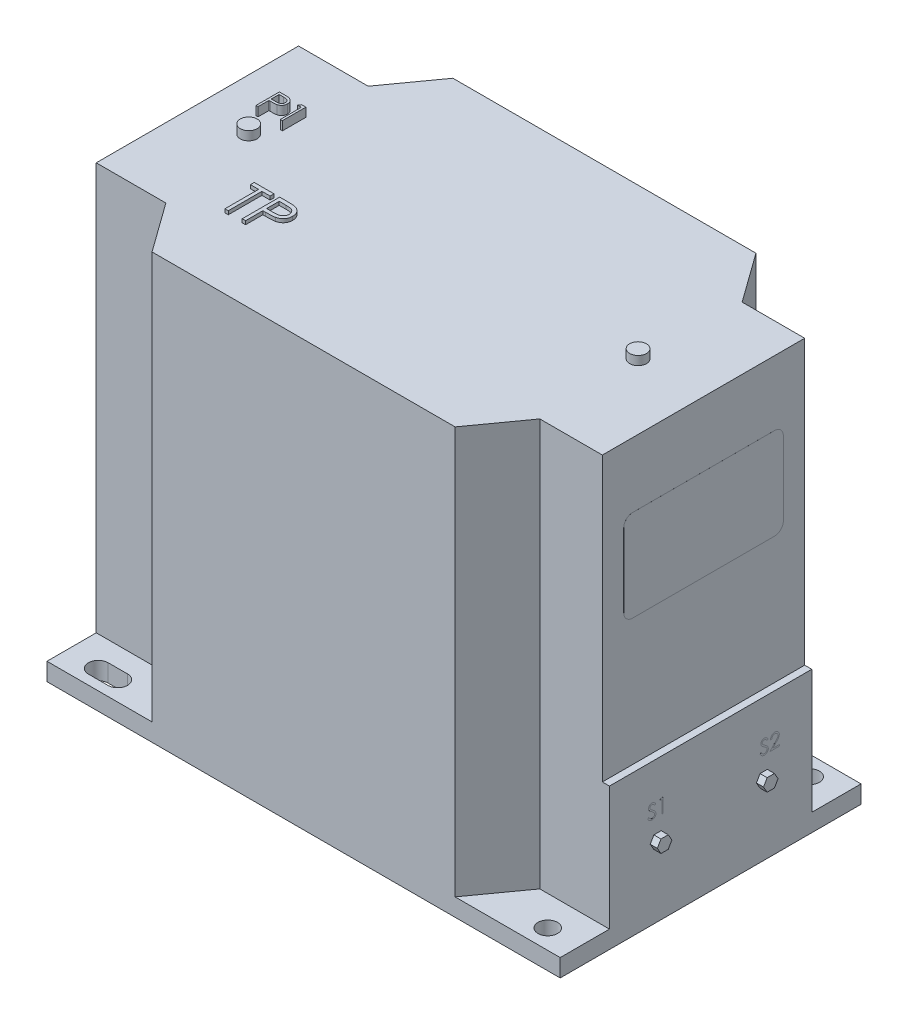
from build123d import *

# Parameters (mm, degrees)
CROQUIS1_W               = 290
CROQUIS1_H               = 170
SALIENTE_EXTRUIR1_DEPTH  = 240
CROQUIS2_R               = 5.5
CORTAR_EXTRUIR1_DEPTH    = 230
CROQUIS3_R               = 5.5
CORTAR_EXTRUIR3_DEPTH    = 309
CROQUIS4_W               = 114.318282822
CROQUIS4_H               = 160
CORTAR_EXTRUIR4_DEPTH    = 4
SALIENTE_EXTRUIR2_DEPTH  = 4
SALIENTE_EXTRUIR3_DEPTH  = 4
SALIENTE_EXTRUIR5_DEPTH  = 4
SALIENTE_EXTRUIR6_DEPTH  = 0.01
SALIENTE_EXTRUIR7_DEPTH  = 0.01
SALIENTE_EXTRUIR8_DEPTH  = 0.01
CROQUIS11_R              = 4.75
SALIENTE_EXTRUIR9_DEPTH  = 5
CROQUIS12_W              = 19.477537379
CROQUIS12_H              = 1.947753737
CROQUIS12_W_2            = 14.751875946
CROQUIS12_H_2            = 1.829107359
CROQUIS12_W_3            = 5.2253802
CROQUIS12_H_3            = 1.246064316
CROQUIS12_W_4            = 1.909821467
CROQUIS12_H_4            = 22.488415391
CROQUIS12_W_5            = 10.038203482
CROQUIS12_H_5            = 1.679080429
SALIENTE_EXTRUIR10_DEPTH = 0.1
SALIENTE_EXTRUIR11_DEPTH = 2


with BuildPart() as part:
    # Croquis1 → Saliente-Extruir1 (new body)
    with BuildSketch(Plane(origin=(0, 0, 0), x_dir=(1, 0, 0), z_dir=(0, 1, 0))):
        Rectangle(CROQUIS1_W, CROQUIS1_H)
    extrude(amount=SALIENTE_EXTRUIR1_DEPTH)

    # Croquis2 → Cortar-Extruir1 (cut)
    # profile 1 of 4: a face of its own
    with BuildSketch(Plane(origin=(0, 240, 0), x_dir=(1, 0, 0), z_dir=(0, 1, 0))):
        Polygon((-145, 85), (-145, 57.159141411), (-105.653068474, 57.159141411), (-85.626113794, 85), align=None)
        with BuildLine():
            ThreePointArc((-127, 68.5), (-132.5, 74), (-127, 79.5))
            Line((-127, 79.5), (-116, 79.5))
            ThreePointArc((-116, 79.5), (-110.5, 74), (-116, 68.5))
            Line((-116, 68.5), (-127, 68.5))
        make_face(mode=Mode.SUBTRACT)
    # profile 2 of 4: a face of its own
    with BuildSketch(Plane(origin=(0, 240, 0), x_dir=(1, 0, 0), z_dir=(0, 1, 0))):
        Polygon((-105.653068474, -57.159141411), (-145, -57.159141411), (-145, -85), (-85.626113794, -85), align=None)
        with BuildLine():
            Line((-116, -79.5), (-127, -79.5))
            ThreePointArc((-127, -79.5), (-132.5, -74), (-127, -68.5))
            Line((-127, -68.5), (-116, -68.5))
            ThreePointArc((-116, -68.5), (-110.5, -74), (-116, -79.5))
        make_face(mode=Mode.SUBTRACT)
    # profile 3 of 4: a face of its own
    with BuildSketch(Plane(origin=(0, 240, 0), x_dir=(1, 0, 0), z_dir=(0, 1, 0))):
        Polygon((145, 85), (85.626113794, 85), (105.653068474, 57.159141411), (145, 57.159141411), align=None)
        with Locations((127, 74)):
            Circle(CROQUIS2_R, mode=Mode.SUBTRACT)
    # profile 4 of 4: a face of its own
    with BuildSketch(Plane(origin=(0, 240, 0), x_dir=(1, 0, 0), z_dir=(0, 1, 0))):
        Polygon((105.653068474, -57.159141411), (85.626113794, -85), (145, -85), (145, -57.159141411), align=None)
        with Locations((127, -74)):
            Circle(CROQUIS2_R, mode=Mode.SUBTRACT)
    extrude(amount=-CORTAR_EXTRUIR1_DEPTH, mode=Mode.SUBTRACT)

    # Croquis3 → Cortar-Extruir3 (cut)
    with BuildSketch(Plane(origin=(0, 240, 0), x_dir=(1, 0, 0), z_dir=(0, 1, 0))):
        with Locations((127, 74)):
            Circle(CROQUIS3_R)
        with Locations((127, -74)):
            Circle(CROQUIS3_R)
        with BuildLine():
            Line((-127, 79.5), (-116, 79.5))
            ThreePointArc((-116, 79.5), (-110.5, 74), (-116, 68.5))
            Line((-116, 68.5), (-127, 68.5))
            ThreePointArc((-127, 68.5), (-132.5, 74), (-127, 79.5))
        make_face()
        with BuildLine():
            Line((-127, -68.426195021), (-116, -68.426195021))
            ThreePointArc((-116, -68.426195021), (-110.426195021, -74), (-116, -79.573804979))
            Line((-116, -79.573804979), (-127, -79.573804979))
            ThreePointArc((-127, -79.573804979), (-132.573804979, -74), (-127, -68.426195021))
        make_face()
    extrude(amount=-CORTAR_EXTRUIR3_DEPTH, mode=Mode.SUBTRACT)

    # Croquis4 → Cortar-Extruir4 (cut)
    with BuildSketch(Plane(origin=(145, 0, 0), x_dir=(0, 0, -1), z_dir=(1, 0, 0))):
        with Locations((0, 160)):
            Rectangle(CROQUIS4_W, CROQUIS4_H)
    extrude(amount=-CORTAR_EXTRUIR4_DEPTH, mode=Mode.SUBTRACT)

    # Croquis5 → Saliente-Extruir2 (add)
    with BuildSketch(Plane.ZY.offset(145)):
        Polygon((43.413866741, 29.419642397), (40.989340839, 33.619044445), (36.140289034, 33.619044445), (33.715763131, 29.419642397), (36.140289034, 25.220240349), (40.989340839, 25.220240349), align=None)
    extrude(amount=SALIENTE_EXTRUIR2_DEPTH)

    # Croquis6 → Saliente-Extruir3 (add)
    with BuildSketch(Plane.ZY.offset(145)):
        Polygon((43.413866741, 74.385865647), (40.989340839, 78.585267695), (36.140289034, 78.585267695), (33.715763131, 74.385865647), (36.140289034, 70.186463599), (40.989340839, 70.186463599), align=None)
    extrude(amount=SALIENTE_EXTRUIR3_DEPTH)

    # Croquis7 → Saliente-Extruir5 (add)
    with BuildSketch(Plane(origin=(145, 0, 0), x_dir=(0, 0, -1), z_dir=(1, 0, 0))):
        Polygon((-27.944874359, 36.440417974), (-32.055125641, 36.440417974), (-34.110251282, 40), (-32.055125641, 43.559582026), (-27.944874359, 43.559582026), (-25.889748718, 40), align=None)
        Polygon((34.110251282, 40), (32.055125641, 43.559582026), (27.944874359, 43.559582026), (25.889748718, 40), (27.944874359, 36.440417974), (32.055125641, 36.440417974), align=None)
    extrude(amount=SALIENTE_EXTRUIR5_DEPTH)

    # Croquis8 → Saliente-Extruir6 (add)
    with BuildSketch(Plane(origin=(145, 0, 0), x_dir=(0, 0, -1), z_dir=(1, 0, 0))):
        with BuildLine():
            Line((-35.585423462, 53.072879107), (-34.914424864, 53.475160256))
            add(Edge.make_bspline(
                [(-34.914424864, 53.475160256), (-34.852017433, 53.370692812), (-34.732447204, 53.17053722), (-34.532986086, 52.900077021), (-34.326309663, 52.67020213), (-34.110887424, 52.482249823), (-33.888034292, 52.33427467), (-33.656295455, 52.229494608), (-33.416451849, 52.164144093), (-33.253225504, 52.156206397), (-33.171736563, 52.15224359)],
                knots=[0, 0, 0, 0, 1.272034388, 2.437168799, 3.508375237, 4.49857839, 5.41946034, 6.295179144, 7.148887113, 8, 8, 8, 8], degree=3))
            add(Edge.make_bspline(
                [(-33.171736563, 52.15224359), (-33.102143147, 52.154181865), (-32.964174037, 52.1580245), (-32.761059665, 52.194947033), (-32.563797363, 52.251670968), (-32.376452774, 52.332907724), (-32.201610934, 52.431193218), (-32.048288607, 52.549906871), (-31.915741172, 52.682817373), (-31.80731693, 52.831095893), (-31.72413185, 52.990565141), (-31.660196266, 53.154249888), (-31.624715474, 53.324721462), (-31.619370694, 53.439498762), (-31.616673462, 53.497420873)],
                knots=[0, 0, 0, 0, 1.095163259, 2.171163733, 3.241058638, 4.321873601, 5.38011039, 6.391990106, 7.366004449, 8.327778327, 9.272591725, 10.192022065, 11.087607919, 12, 12, 12, 12], degree=3))
            add(Edge.make_bspline(
                [(-31.616673462, 53.497420873), (-31.620016988, 53.563508158), (-31.626813888, 53.697853949), (-31.684262066, 53.896063876), (-31.774634465, 54.092216669), (-31.858006889, 54.213549896), (-31.901291351, 54.276542468)],
                knots=[0, 0, 0, 0, 0.938893495, 1.908633276, 2.914225137, 4, 4, 4, 4], degree=3))
            add(Edge.make_bspline(
                [(-31.901291351, 54.276542468), (-31.936830065, 54.3220058), (-32.01143915, 54.417450379), (-32.139703509, 54.559520824), (-32.290212376, 54.706066167), (-32.45781508, 54.862682242), (-32.648616907, 55.022084924), (-32.856641806, 55.191875483), (-33.087200914, 55.365596917), (-33.248897987, 55.482102556), (-33.332331014, 55.542217548)],
                knots=[0, 0, 0, 0, 0.722233717, 1.516239348, 2.393582979, 3.351407094, 4.387010283, 5.505090956, 6.712668013, 8, 8, 8, 8], degree=3))
            add(Edge.make_bspline(
                [(-33.332331014, 55.542217548), (-33.415842577, 55.601700238), (-33.575510326, 55.715426611), (-33.798800325, 55.884210255), (-33.998472589, 56.038524031), (-34.173639645, 56.17982063), (-34.324224445, 56.308119215), (-34.451413609, 56.422187756), (-34.551967122, 56.525111189), (-34.607882457, 56.591879946), (-34.632987064, 56.621857472)],
                knots=[0, 0, 0, 0, 1.452282411, 2.77665338, 3.964542531, 5.026858415, 5.96415736, 6.766646006, 7.446254459, 8, 8, 8, 8], degree=3))
            add(Edge.make_bspline(
                [(-34.632987064, 56.621857472), (-34.668076586, 56.668577681), (-34.737084841, 56.760459241), (-34.828175603, 56.904070972), (-34.905598347, 57.051080877), (-34.966291493, 57.201883999), (-35.017400418, 57.354363212), (-35.05177644, 57.510508002), (-35.073301572, 57.669617726), (-35.075505899, 57.7766912), (-35.07660936, 57.830290966)],
                knots=[0, 0, 0, 0, 1.068054152, 2.10047183, 3.106115577, 4.101338837, 5.06977816, 6.043150881, 7.020423561, 8, 8, 8, 8], degree=3))
            add(Edge.make_bspline(
                [(-35.07660936, 57.830290966), (-35.073649332, 57.914269204), (-35.067792545, 58.080430706), (-35.018261372, 58.323161339), (-34.940081774, 58.554905535), (-34.830555868, 58.773368971), (-34.689365085, 58.972863249), (-34.525975108, 59.155683121), (-34.331366916, 59.309372584), (-34.117842217, 59.443657074), (-33.884125087, 59.548763012), (-33.639217145, 59.62804952), (-33.382729143, 59.672974087), (-33.209004177, 59.679421071), (-33.120855153, 59.682692308)],
                knots=[0, 0, 0, 0, 1.005424448, 1.989358655, 2.955360095, 3.929531133, 4.905563448, 5.876582895, 6.856512386, 7.866279853, 8.892233794, 9.918561126, 10.94386622, 12, 12, 12, 12], degree=3))
            add(Edge.make_bspline(
                [(-33.120855153, 59.682692308), (-33.027319425, 59.679466164), (-32.841306717, 59.673050394), (-32.567691532, 59.617266706), (-32.304255621, 59.524963397), (-32.092339646, 59.420214119), (-31.92648499, 59.315594659), (-31.8000004, 59.2202997), (-31.671826896, 59.110591864), (-31.540930593, 58.986178931), (-31.409529454, 58.845919335), (-31.275672696, 58.690773666), (-31.139047301, 58.521690048), (-31.051154547, 58.400984484), (-31.006096539, 58.339105068)],
                knots=[0, 0, 0, 0, 1.286793592, 2.559021753, 3.825965368, 5.121522368, 5.803751409, 6.523245864, 7.299691795, 8.125521123, 9.008227632, 9.944561021, 10.946284179, 12, 12, 12, 12], degree=3))
            Line((-31.006096539, 58.339105068), (-31.650064388, 57.850961538))
            add(Edge.make_bspline(
                [(-31.650064388, 57.850961538), (-31.688948913, 57.901055533), (-31.763831417, 57.997524854), (-31.877517932, 58.132624087), (-31.984671116, 58.256032889), (-32.090240773, 58.363223447), (-32.18865133, 58.460065785), (-32.284166765, 58.542978091), (-32.375412526, 58.612772745), (-32.490431234, 58.687257247), (-32.634933916, 58.761090746), (-32.816327418, 58.823568119), (-33.005889149, 58.861112635), (-33.13499742, 58.866076719), (-33.200357356, 58.868589744)],
                knots=[0, 0, 0, 0, 1.181633172, 2.275549214, 3.290209073, 4.226197932, 5.078386478, 5.862611352, 6.581680152, 7.217281963, 8.414376989, 9.595101626, 10.782541182, 12, 12, 12, 12], degree=3))
            add(Edge.make_bspline(
                [(-33.200357356, 58.868589744), (-33.282355184, 58.865841781), (-33.44048027, 58.860542595), (-33.664975984, 58.802666914), (-33.867028278, 58.711540195), (-34.04063856, 58.583825869), (-34.185184919, 58.43251219), (-34.289745513, 58.258388715), (-34.352678921, 58.066114337), (-34.36035852, 57.93198951), (-34.364269616, 57.863681891)],
                knots=[0, 0, 0, 0, 1.14458467, 2.207223713, 3.21896685, 4.227309161, 5.202851033, 6.127160689, 7.046193047, 8, 8, 8, 8], degree=3))
            add(Edge.make_bspline(
                [(-34.364269616, 57.863681891), (-34.363378061, 57.821156216), (-34.361593493, 57.73603533), (-34.33670422, 57.610279426), (-34.304728956, 57.48484121), (-34.254059059, 57.360284638), (-34.184106317, 57.23443136), (-34.092246364, 57.105114205), (-33.97655546, 56.971193366), (-33.887934378, 56.884090929), (-33.841145117, 56.838103466)],
                knots=[0, 0, 0, 0, 0.858281714, 1.717966888, 2.583508476, 3.4729293, 4.427298488, 5.488583878, 6.674047936, 8, 8, 8, 8], degree=3))
            add(Edge.make_bspline(
                [(-33.841145117, 56.838103466), (-33.823770219, 56.822598068), (-33.782491438, 56.785760792), (-33.707026392, 56.725453298), (-33.607370403, 56.651061297), (-33.486125768, 56.559015061), (-33.34105693, 56.452241031), (-33.172147937, 56.332104446), (-32.981281603, 56.19470528), (-32.84584083, 56.098644429), (-32.774225545, 56.047851563)],
                knots=[0, 0, 0, 0, 0.420754252, 0.999615792, 1.744751191, 2.668019286, 3.750313428, 4.999500688, 6.413464383, 8, 8, 8, 8], degree=3))
            add(Edge.make_bspline(
                [(-32.774225545, 56.047851563), (-32.688078921, 55.985164908), (-32.521267921, 55.863780889), (-32.283919481, 55.681409615), (-32.068713881, 55.503047711), (-31.874895544, 55.329834209), (-31.700549698, 55.163082998), (-31.547610582, 55.000787929), (-31.414519842, 54.844111719), (-31.2712384, 54.643241771), (-31.124830488, 54.396541812), (-30.99909707, 54.094285807), (-30.919816532, 53.790854865), (-30.909448988, 53.586913647), (-30.904333719, 53.486290565)],
                knots=[0, 0, 0, 0, 1.163667725, 2.253281268, 3.268753668, 4.215851969, 5.092017293, 5.902905408, 6.650798638, 7.335211899, 8.59617414, 9.77448103, 10.901945474, 12, 12, 12, 12], degree=3))
            add(Edge.make_bspline(
                [(-30.904333719, 53.486290565), (-30.905824014, 53.415128915), (-30.908775664, 53.274187528), (-30.942704879, 53.06723405), (-30.992415549, 52.866231899), (-31.067339276, 52.673665626), (-31.158786438, 52.486012325), (-31.274824179, 52.308194408), (-31.409325535, 52.136276326), (-31.563616395, 51.974842336), (-31.732449066, 51.826646499), (-31.910892445, 51.694818092), (-32.0992386, 51.584898858), (-32.296465782, 51.495203199), (-32.502619296, 51.4250504), (-32.717629806, 51.374221215), (-32.941851733, 51.343025227), (-33.094252825, 51.339787268), (-33.171736563, 51.338141026)],
                knots=[0, 0, 0, 0, 0.983748083, 1.948392443, 2.894712957, 3.844097841, 4.80183111, 5.778335162, 6.776009319, 7.81870978, 8.863265674, 9.881300176, 10.883814829, 11.87499822, 12.874611388, 13.892143829, 14.928324115, 16, 16, 16, 16], degree=3))
            add(Edge.make_bspline(
                [(-33.171736563, 51.338141026), (-33.231688144, 51.339300312), (-33.350836279, 51.341604286), (-33.527070282, 51.361972547), (-33.699743994, 51.390790443), (-33.866690669, 51.436542351), (-34.030061227, 51.492052639), (-34.189145134, 51.560402072), (-34.344019489, 51.642310725), (-34.495552221, 51.735961941), (-34.643357939, 51.844950041), (-34.786050303, 51.971889934), (-34.928311135, 52.113280633), (-35.06594148, 52.272961732), (-35.201725218, 52.448353456), (-35.332985182, 52.641096782), (-35.462438364, 52.850141853), (-35.543662728, 52.997246601), (-35.585423462, 53.072879107)],
                knots=[0, 0, 0, 0, 0.915332311, 1.819136955, 2.706846663, 3.586547465, 4.459518054, 5.340707479, 6.227863349, 7.133153174, 8.059268498, 9.028702269, 10.047606654, 11.120612155, 12.245963614, 13.433783089, 14.680604001, 16, 16, 16, 16], degree=3))
        make_face()
        Polygon((-28.301431575, 59.479166667), (-26.833820898, 59.479166667), (-26.833820898, 51.541666667), (-27.546160642, 51.541666667), (-27.546160642, 58.665064103), (-28.767314488, 58.665064103), align=None)
        with BuildLine():
            Line((27.914576538, 53.072879107), (28.585575136, 53.475160256))
            add(Edge.make_bspline(
                [(28.585575136, 53.475160256), (28.647982567, 53.370692812), (28.767552796, 53.17053722), (28.967013914, 52.900077021), (29.173690337, 52.67020213), (29.389112576, 52.482249823), (29.611965708, 52.33427467), (29.843704545, 52.229494608), (30.083548151, 52.164144093), (30.246774496, 52.156206397), (30.328263437, 52.15224359)],
                knots=[0, 0, 0, 0, 1.272034388, 2.437168799, 3.508375237, 4.49857839, 5.41946034, 6.295179144, 7.148887113, 8, 8, 8, 8], degree=3))
            add(Edge.make_bspline(
                [(30.328263437, 52.15224359), (30.397856853, 52.154181865), (30.535825963, 52.1580245), (30.738940335, 52.194947033), (30.936202637, 52.251670968), (31.123547226, 52.332907724), (31.298389066, 52.431193218), (31.451711393, 52.549906871), (31.584258828, 52.682817373), (31.69268307, 52.831095893), (31.77586815, 52.990565141), (31.839803734, 53.154249888), (31.875284526, 53.324721462), (31.880629306, 53.439498762), (31.883326538, 53.497420873)],
                knots=[0, 0, 0, 0, 1.095163259, 2.171163733, 3.241058638, 4.321873601, 5.38011039, 6.391990106, 7.366004449, 8.327778327, 9.272591725, 10.192022065, 11.087607919, 12, 12, 12, 12], degree=3))
            add(Edge.make_bspline(
                [(31.883326538, 53.497420873), (31.879983012, 53.563508158), (31.873186112, 53.697853949), (31.815737934, 53.896063876), (31.725365535, 54.092216669), (31.641993111, 54.213549896), (31.598708649, 54.276542468)],
                knots=[0, 0, 0, 0, 0.938893495, 1.908633276, 2.914225137, 4, 4, 4, 4], degree=3))
            add(Edge.make_bspline(
                [(31.598708649, 54.276542468), (31.563169935, 54.3220058), (31.48856085, 54.417450379), (31.360296491, 54.559520824), (31.209787624, 54.706066167), (31.04218492, 54.862682242), (30.851383093, 55.022084924), (30.643358194, 55.191875483), (30.412799086, 55.365596917), (30.251102013, 55.482102556), (30.167668986, 55.542217548)],
                knots=[0, 0, 0, 0, 0.722233717, 1.516239348, 2.393582979, 3.351407094, 4.387010283, 5.505090956, 6.712668013, 8, 8, 8, 8], degree=3))
            add(Edge.make_bspline(
                [(30.167668986, 55.542217548), (30.084157423, 55.601700238), (29.924489674, 55.715426611), (29.701199675, 55.884210255), (29.501527411, 56.038524031), (29.326360355, 56.17982063), (29.175775555, 56.308119215), (29.048586391, 56.422187756), (28.948032878, 56.525111189), (28.892117543, 56.591879946), (28.867012936, 56.621857472)],
                knots=[0, 0, 0, 0, 1.452282411, 2.77665338, 3.964542531, 5.026858415, 5.96415736, 6.766646006, 7.446254459, 8, 8, 8, 8], degree=3))
            add(Edge.make_bspline(
                [(28.867012936, 56.621857472), (28.831923414, 56.668577681), (28.762915159, 56.760459241), (28.671824397, 56.904070972), (28.594401653, 57.051080877), (28.533708507, 57.201883999), (28.482599582, 57.354363212), (28.44822356, 57.510508002), (28.426698428, 57.669617726), (28.424494101, 57.7766912), (28.42339064, 57.830290966)],
                knots=[0, 0, 0, 0, 1.068054152, 2.10047183, 3.106115577, 4.101338837, 5.06977816, 6.043150881, 7.020423561, 8, 8, 8, 8], degree=3))
            add(Edge.make_bspline(
                [(28.42339064, 57.830290966), (28.426350668, 57.914269204), (28.432207455, 58.080430706), (28.481738628, 58.323161339), (28.559918226, 58.554905535), (28.669444132, 58.773368971), (28.810634915, 58.972863249), (28.974024892, 59.155683121), (29.168633084, 59.309372584), (29.382157783, 59.443657074), (29.615874913, 59.548763012), (29.860782855, 59.62804952), (30.117270857, 59.672974087), (30.290995823, 59.679421071), (30.379144847, 59.682692308)],
                knots=[0, 0, 0, 0, 1.005424448, 1.989358655, 2.955360095, 3.929531133, 4.905563448, 5.876582895, 6.856512386, 7.866279853, 8.892233794, 9.918561126, 10.94386622, 12, 12, 12, 12], degree=3))
            add(Edge.make_bspline(
                [(30.379144847, 59.682692308), (30.472680575, 59.679466164), (30.658693283, 59.673050394), (30.932308468, 59.617266706), (31.195744379, 59.524963397), (31.407660354, 59.420214119), (31.57351501, 59.315594659), (31.6999996, 59.2202997), (31.828173104, 59.110591864), (31.959069407, 58.986178931), (32.090470546, 58.845919335), (32.224327304, 58.690773666), (32.360952699, 58.521690048), (32.448845453, 58.400984484), (32.493903461, 58.339105068)],
                knots=[0, 0, 0, 0, 1.286793592, 2.559021753, 3.825965368, 5.121522368, 5.803751409, 6.523245864, 7.299691795, 8.125521123, 9.008227632, 9.944561021, 10.946284179, 12, 12, 12, 12], degree=3))
            Line((32.493903461, 58.339105068), (31.849935612, 57.850961538))
            add(Edge.make_bspline(
                [(31.849935612, 57.850961538), (31.811051087, 57.901055533), (31.736168583, 57.997524854), (31.622482068, 58.132624087), (31.515328884, 58.256032889), (31.409759227, 58.363223447), (31.31134867, 58.460065785), (31.215833235, 58.542978091), (31.124587474, 58.612772745), (31.009568766, 58.687257247), (30.865066084, 58.761090746), (30.683672582, 58.823568119), (30.494110851, 58.861112635), (30.36500258, 58.866076719), (30.299642644, 58.868589744)],
                knots=[0, 0, 0, 0, 1.181633172, 2.275549214, 3.290209073, 4.226197932, 5.078386478, 5.862611352, 6.581680152, 7.217281963, 8.414376989, 9.595101626, 10.782541182, 12, 12, 12, 12], degree=3))
            add(Edge.make_bspline(
                [(30.299642644, 58.868589744), (30.217644816, 58.865841781), (30.05951973, 58.860542595), (29.835024016, 58.802666914), (29.632971722, 58.711540195), (29.45936144, 58.583825869), (29.314815081, 58.43251219), (29.210254487, 58.258388715), (29.147321079, 58.066114337), (29.13964148, 57.93198951), (29.135730384, 57.863681891)],
                knots=[0, 0, 0, 0, 1.14458467, 2.207223713, 3.21896685, 4.227309161, 5.202851033, 6.127160689, 7.046193047, 8, 8, 8, 8], degree=3))
            add(Edge.make_bspline(
                [(29.135730384, 57.863681891), (29.136621939, 57.821156216), (29.138406507, 57.73603533), (29.16329578, 57.610279426), (29.195271044, 57.48484121), (29.245940941, 57.360284638), (29.315893683, 57.23443136), (29.407753636, 57.105114205), (29.52344454, 56.971193366), (29.612065622, 56.884090929), (29.658854883, 56.838103466)],
                knots=[0, 0, 0, 0, 0.858281714, 1.717966888, 2.583508476, 3.4729293, 4.427298488, 5.488583878, 6.674047936, 8, 8, 8, 8], degree=3))
            add(Edge.make_bspline(
                [(29.658854883, 56.838103466), (29.676229781, 56.822598068), (29.717508562, 56.785760792), (29.792973608, 56.725453298), (29.892629597, 56.651061297), (30.013874232, 56.559015061), (30.15894307, 56.452241031), (30.327852063, 56.332104446), (30.518718397, 56.19470528), (30.65415917, 56.098644429), (30.725774455, 56.047851563)],
                knots=[0, 0, 0, 0, 0.420754252, 0.999615792, 1.744751191, 2.668019286, 3.750313428, 4.999500688, 6.413464383, 8, 8, 8, 8], degree=3))
            add(Edge.make_bspline(
                [(30.725774455, 56.047851563), (30.811921079, 55.985164908), (30.978732079, 55.863780889), (31.216080519, 55.681409615), (31.431286119, 55.503047711), (31.625104456, 55.329834209), (31.799450302, 55.163082998), (31.952389418, 55.000787929), (32.085480158, 54.844111719), (32.2287616, 54.643241771), (32.375169512, 54.396541812), (32.50090293, 54.094285807), (32.580183468, 53.790854865), (32.590551012, 53.586913647), (32.595666281, 53.486290565)],
                knots=[0, 0, 0, 0, 1.163667725, 2.253281268, 3.268753668, 4.215851969, 5.092017293, 5.902905408, 6.650798638, 7.335211899, 8.59617414, 9.77448103, 10.901945474, 12, 12, 12, 12], degree=3))
            add(Edge.make_bspline(
                [(32.595666281, 53.486290565), (32.594175986, 53.415128915), (32.591224336, 53.274187528), (32.557295121, 53.06723405), (32.507584451, 52.866231899), (32.432660724, 52.673665626), (32.341213562, 52.486012325), (32.225175821, 52.308194408), (32.090674465, 52.136276326), (31.936383605, 51.974842336), (31.767550934, 51.826646499), (31.589107555, 51.694818092), (31.4007614, 51.584898858), (31.203534218, 51.495203199), (30.997380704, 51.4250504), (30.782370194, 51.374221215), (30.558148267, 51.343025227), (30.405747175, 51.339787268), (30.328263437, 51.338141026)],
                knots=[0, 0, 0, 0, 0.983748083, 1.948392443, 2.894712957, 3.844097841, 4.80183111, 5.778335162, 6.776009319, 7.81870978, 8.863265674, 9.881300176, 10.883814829, 11.87499822, 12.874611388, 13.892143829, 14.928324115, 16, 16, 16, 16], degree=3))
            add(Edge.make_bspline(
                [(30.328263437, 51.338141026), (30.268311856, 51.339300312), (30.149163721, 51.341604286), (29.972929718, 51.361972547), (29.800256006, 51.390790443), (29.633309331, 51.436542351), (29.469938773, 51.492052639), (29.310854866, 51.560402072), (29.155980511, 51.642310725), (29.004447779, 51.735961941), (28.856642061, 51.844950041), (28.713949697, 51.971889934), (28.571688865, 52.113280633), (28.43405852, 52.272961732), (28.298274782, 52.448353456), (28.167014818, 52.641096782), (28.037561636, 52.850141853), (27.956337272, 52.997246601), (27.914576538, 53.072879107)],
                knots=[0, 0, 0, 0, 0.915332311, 1.819136955, 2.706846663, 3.586547465, 4.459518054, 5.340707479, 6.227863349, 7.133153174, 8.059268498, 9.028702269, 10.047606654, 11.120612155, 12.245963614, 13.433783089, 14.680604001, 16, 16, 16, 16], degree=3))
        make_face()
        with BuildLine():
            Line((34.529159871, 57.036858974), (33.816820128, 57.036858974))
            add(Edge.make_bspline(
                [(33.816820128, 57.036858974), (33.821462778, 57.131362595), (33.83058082, 57.31696519), (33.873280691, 57.587574764), (33.934378751, 57.846234754), (34.020764728, 58.090868309), (34.128048607, 58.323638461), (34.256704205, 58.543620639), (34.409090259, 58.749975657), (34.581916245, 58.940790533), (34.769623695, 59.115840917), (34.972156807, 59.267005486), (35.184983923, 59.394725919), (35.407459345, 59.501499449), (35.642093123, 59.581645171), (35.886756033, 59.641112104), (36.142523003, 59.676890602), (36.316785196, 59.680736402), (36.405411874, 59.682692308)],
                knots=[0, 0, 0, 0, 1.10065271, 2.161652631, 3.183658789, 4.190468796, 5.17591951, 6.163126047, 7.15150782, 8.156236427, 9.156009102, 10.134482811, 11.092018607, 12.041330605, 13.001268258, 13.972401359, 14.968799086, 16, 16, 16, 16], degree=3))
            add(Edge.make_bspline(
                [(36.405411874, 59.682692308), (36.492447864, 59.680654737), (36.663470474, 59.676650983), (36.9130754, 59.642267934), (37.150695335, 59.588416325), (37.375865806, 59.51286172), (37.586790274, 59.411297036), (37.78505325, 59.289291904), (37.973015089, 59.148186215), (38.142212616, 58.982057031), (38.297579153, 58.804705195), (38.431614624, 58.615366556), (38.546398048, 58.419810855), (38.642073679, 58.216546897), (38.712504566, 58.003660815), (38.765976573, 57.78425198), (38.796201244, 57.556049284), (38.800839972, 57.401593345), (38.803198333, 57.323066907)],
                knots=[0, 0, 0, 0, 1.111607364, 2.184268762, 3.212621178, 4.221274766, 5.211760367, 6.196651075, 7.1921475, 8.207485113, 9.220403448, 10.201281604, 11.166441695, 12.114753415, 13.065576456, 14.026450734, 14.996634279, 16, 16, 16, 16], degree=3))
            add(Edge.make_bspline(
                [(38.803198333, 57.323066907), (38.799358255, 57.212513782), (38.791745486, 56.993347583), (38.726625382, 56.671278162), (38.624919901, 56.359235944), (38.50246161, 56.108099563), (38.378925889, 55.905730746), (38.267602434, 55.739114219), (38.137280452, 55.559714318), (37.986063144, 55.368131785), (37.817078595, 55.162865982), (37.628796188, 54.94404091), (37.419873292, 54.713917432), (37.273237049, 54.556742229), (37.197253822, 54.475297977)],
                knots=[0, 0, 0, 0, 1.184426356, 2.348067706, 3.509069118, 4.696110526, 5.333549288, 6.050745305, 6.844228056, 7.710549037, 8.667450064, 9.695053472, 10.805634456, 12, 12, 12, 12], degree=3))
            Line((37.197253822, 54.475297977), (35.211288777, 52.355769231))
            Line((35.211288777, 52.355769231), (38.904961153, 52.355769231))
            Line((38.904961153, 52.355769231), (38.904961153, 51.541666667))
            Line((38.904961153, 51.541666667), (33.511531666, 51.541666667))
            Line((33.511531666, 51.541666667), (36.589856987, 54.826697716))
            add(Edge.make_bspline(
                [(36.589856987, 54.826697716), (36.664804873, 54.904934947), (36.808764424, 55.055212656), (37.012378482, 55.274611869), (37.195256187, 55.478151006), (37.358581346, 55.6654455), (37.498810903, 55.839234949), (37.623253286, 55.993890794), (37.722960965, 56.136208923), (37.831172666, 56.301174243), (37.935979374, 56.502587891), (38.026041325, 56.748726794), (38.080957142, 57.002108242), (38.087544893, 57.173336076), (38.090858589, 57.259465144)],
                knots=[0, 0, 0, 0, 1.329631726, 2.553950428, 3.673215718, 4.687767853, 5.603093632, 6.413772471, 7.123043292, 7.734684054, 8.834405432, 9.900288307, 10.943827018, 12, 12, 12, 12], degree=3))
            add(Edge.make_bspline(
                [(38.090858589, 57.259465144), (38.089416816, 57.313624744), (38.086575359, 57.420362916), (38.061498081, 57.576858119), (38.02360104, 57.727817608), (37.969296616, 57.873705726), (37.897617045, 58.013055687), (37.810364915, 58.146037115), (37.709694593, 58.27459959), (37.59323725, 58.395143676), (37.465303982, 58.505545696), (37.330152737, 58.603344961), (37.187164108, 58.685076516), (37.036940974, 58.752076947), (36.879902141, 58.804635401), (36.71574388, 58.841053965), (36.544919772, 58.863919598), (36.428275951, 58.867013345), (36.368840861, 58.868589744)],
                knots=[0, 0, 0, 0, 0.991446411, 1.95395049, 2.89581595, 3.838931463, 4.798493298, 5.75982156, 6.748411868, 7.785213223, 8.824556874, 9.840280684, 10.836137867, 11.835679398, 12.848801643, 13.863922112, 14.911575587, 16, 16, 16, 16], degree=3))
            add(Edge.make_bspline(
                [(36.368840861, 58.868589744), (36.306767722, 58.866968153), (36.184866327, 58.863783616), (36.005889235, 58.841507217), (35.835151846, 58.803076472), (35.672224674, 58.750515085), (35.516832041, 58.683707305), (35.369729656, 58.600495669), (35.231247746, 58.501200962), (35.101125988, 58.388623272), (34.981238036, 58.263284247), (34.875903156, 58.123561653), (34.78386441, 57.972006621), (34.703561327, 57.809028087), (34.63834753, 57.633147193), (34.588515564, 57.444988291), (34.549084679, 57.245368372), (34.535911784, 57.107516483), (34.529159871, 57.036858974)],
                knots=[0, 0, 0, 0, 1.031018746, 2.02475058, 2.990194455, 3.934040569, 4.864654155, 5.795059489, 6.735614925, 7.690564532, 8.649604399, 9.611025574, 10.590972636, 11.591080095, 12.624614302, 13.701020113, 14.821632451, 16, 16, 16, 16], degree=3))
        make_face()
    extrude(amount=SALIENTE_EXTRUIR6_DEPTH)

    # Croquis9 → Saliente-Extruir7 (add)
    # profile 1 of 2: a face of its own
    with BuildSketch(Plane.ZY.offset(145)):
        with BuildLine():
            Line((31.885683761, 114.9375), (34.480105669, 114.9375))
            add(Edge.make_bspline(
                [(34.480105669, 114.9375), (34.658551654, 114.937303845), (35.000462085, 114.936928002), (35.490754111, 114.925532981), (35.936046846, 114.910313043), (36.335380131, 114.889214816), (36.689982645, 114.864281275), (36.998249819, 114.829310769), (37.26260469, 114.792797152), (37.421001091, 114.755674574), (37.493239183, 114.738744491)],
                knots=[0, 0, 0, 0, 1.415646017, 2.712440637, 3.8905458, 4.950247383, 5.884950622, 6.709939814, 7.411656543, 8, 8, 8, 8], degree=3))
            add(Edge.make_bspline(
                [(37.493239183, 114.738744491), (37.58468498, 114.713715097), (37.765421769, 114.664246096), (38.025851307, 114.565164463), (38.273629235, 114.447681279), (38.509605661, 114.313787221), (38.730880796, 114.157737618), (38.940756011, 113.98585817), (39.137379151, 113.794180515), (39.319644531, 113.584854504), (39.487030521, 113.361394187), (39.631151644, 113.120463735), (39.75182896, 112.86611863), (39.855331206, 112.598535786), (39.929824472, 112.315468195), (39.985942218, 112.018882704), (40.021561286, 111.708811107), (40.024972755, 111.496918156), (40.026709402, 111.389051649)],
                knots=[0, 0, 0, 0, 0.999701418, 1.975846123, 2.934577507, 3.890451536, 4.834027766, 5.787354733, 6.749476667, 7.726910423, 8.712836071, 9.690891519, 10.682875813, 11.679750201, 12.712814741, 13.765529915, 14.8625177, 16, 16, 16, 16], degree=3))
            add(Edge.make_bspline(
                [(40.026709402, 111.389051649), (40.025116517, 111.280278505), (40.021999929, 111.067456501), (39.984594327, 110.756106975), (39.934209376, 110.458570202), (39.856735399, 110.17550591), (39.755265146, 109.908595111), (39.636232685, 109.653758907), (39.492663984, 109.415332766), (39.327696919, 109.192451102), (39.144183452, 108.984904707), (38.942900025, 108.794197597), (38.724659247, 108.621446079), (38.490154699, 108.466262876), (38.237100211, 108.332246581), (37.969333738, 108.21221153), (37.68452786, 108.111401271), (37.487441572, 108.058370979), (37.387236245, 108.031408587)],
                knots=[0, 0, 0, 0, 1.121902311, 2.195077645, 3.232258892, 4.234102512, 5.217864754, 6.176164875, 7.132989551, 8.084763148, 9.034132444, 9.988522005, 10.94243251, 11.903244335, 12.886203696, 13.894208494, 14.929344452, 16, 16, 16, 16], degree=3))
            add(Edge.make_bspline(
                [(37.387236245, 108.031408587), (37.304356143, 108.013783629), (37.122719581, 107.975157508), (36.823578935, 107.932036258), (36.475291315, 107.895230445), (36.078332103, 107.867633884), (35.633057611, 107.844008979), (35.139226966, 107.825230767), (34.595870781, 107.81491257), (34.216869353, 107.814380406), (34.018992889, 107.814102564)],
                knots=[0, 0, 0, 0, 0.601384939, 1.31797006, 2.144135048, 3.087295005, 4.142315834, 5.309527816, 6.595305764, 8, 8, 8, 8], degree=3))
            Line((34.018992889, 107.814102564), (33.072916667, 107.814102564))
            Line((33.072916667, 107.814102564), (33.072916667, 101.708333333))
            Line((33.072916667, 101.708333333), (31.885683761, 101.708333333))
            Line((31.885683761, 101.708333333), (31.885683761, 114.9375))
        make_face()
        with BuildLine():
            Line((33.072916667, 113.580662393), (33.072916667, 109.170940171))
            Line((33.072916667, 109.170940171), (35.389080863, 109.141789363))
            add(Edge.make_bspline(
                [(35.389080863, 109.141789363), (35.502171058, 109.141730914), (35.72048935, 109.14161808), (36.035858408, 109.156681276), (36.328447083, 109.174070194), (36.597356639, 109.199530381), (36.842708296, 109.235518468), (37.064911158, 109.271848548), (37.262242257, 109.324407508), (37.493182692, 109.395176252), (37.750521536, 109.515873936), (38.030479234, 109.691065485), (38.267737105, 109.914376495), (38.473047334, 110.165457881), (38.635977289, 110.444778995), (38.755251427, 110.74364075), (38.825332587, 111.058978157), (38.834729807, 111.27475773), (38.839476496, 111.383751502)],
                knots=[0, 0, 0, 0, 1.160613943, 2.240541288, 3.23993089, 4.169200891, 5.011653406, 5.7853311, 6.478053781, 7.106038997, 8.262395093, 9.384106736, 10.481365981, 11.59014053, 12.70357646, 13.786202915, 14.881775077, 16, 16, 16, 16], degree=3))
            add(Edge.make_bspline(
                [(38.839476496, 111.383751502), (38.834703993, 111.490108384), (38.825216847, 111.7015327), (38.754702126, 112.011392896), (38.636209184, 112.307105231), (38.471953603, 112.58292612), (38.27260469, 112.833104039), (38.040907768, 113.05042949), (37.777408238, 113.225136521), (37.532297365, 113.337899222), (37.314578596, 113.406748627), (37.1254697, 113.454921089), (36.911948401, 113.493382458), (36.673945187, 113.524525817), (36.413304773, 113.551186221), (36.127787928, 113.569276075), (35.818476241, 113.579864913), (35.603745809, 113.58039013), (35.492433727, 113.580662393)],
                knots=[0, 0, 0, 0, 1.120700087, 2.227813068, 3.331159281, 4.466773991, 5.599788987, 6.693661531, 7.80175334, 8.91857717, 9.525282508, 10.207424825, 10.974604443, 11.810962634, 12.737642355, 13.736264703, 14.826523623, 16, 16, 16, 16], degree=3))
            Line((35.492433727, 113.580662393), (33.072916667, 113.580662393))
        make_face(mode=Mode.SUBTRACT)
    # profile 2 of 2: a face of its own
    with BuildSketch(Plane.ZY.offset(145)):
        with BuildLine():
            Line((43.249198718, 110.866987179), (42.061965812, 110.866987179))
            add(Edge.make_bspline(
                [(42.061965812, 110.866987179), (42.069703563, 111.024493214), (42.0849003, 111.333830873), (42.15606675, 111.784846829), (42.257896852, 112.215946812), (42.401873478, 112.623669403), (42.580679945, 113.011619657), (42.795105941, 113.378256621), (43.049082698, 113.72218165), (43.337126008, 114.040206444), (43.649971757, 114.331957084), (43.987526945, 114.583898031), (44.342238804, 114.79676542), (44.713031175, 114.974721305), (45.104087472, 115.108297508), (45.511858988, 115.207409062), (45.938137271, 115.267039893), (46.228574259, 115.273449559), (46.37628539, 115.276709402)],
                knots=[0, 0, 0, 0, 1.10065271, 2.161652631, 3.183658789, 4.190468796, 5.17591951, 6.163126047, 7.15150782, 8.156236427, 9.156009102, 10.134482811, 11.092018607, 12.041330605, 13.001268258, 13.972401359, 14.968799086, 16, 16, 16, 16], degree=3))
            add(Edge.make_bspline(
                [(46.37628539, 115.276709402), (46.521345372, 115.27331345), (46.806383056, 115.266640527), (47.222391265, 115.209335446), (47.618424492, 115.119582763), (47.993708609, 114.993658422), (48.345249389, 114.824383949), (48.675687682, 114.621042062), (48.988957413, 114.385865914), (49.270953292, 114.10898394), (49.52989752, 113.813397547), (49.753289973, 113.497833149), (49.94459568, 113.17190698), (50.104055065, 112.833133718), (50.221439876, 112.478323581), (50.310559888, 112.112642189), (50.360934339, 111.732304362), (50.368665553, 111.474877798), (50.372596154, 111.344000401)],
                knots=[0, 0, 0, 0, 1.111607364, 2.184268762, 3.212621178, 4.221274766, 5.211760367, 6.196651075, 7.1921475, 8.207485113, 9.220403448, 10.201281604, 11.166441695, 12.114753415, 13.065576456, 14.026450734, 14.996634279, 16, 16, 16, 16], degree=3))
            add(Edge.make_bspline(
                [(50.372596154, 111.344000401), (50.366196023, 111.159745193), (50.353508076, 110.794468194), (50.244974569, 110.257685826), (50.075465435, 109.737615463), (49.871368283, 109.319054827), (49.665475414, 108.981773466), (49.479936322, 108.704079254), (49.262733019, 108.405079418), (49.010704172, 108.085775197), (48.729063257, 107.743665526), (48.415259246, 107.378957073), (48.067054419, 106.995417943), (47.822660681, 106.733459271), (47.696021968, 106.59771885)],
                knots=[0, 0, 0, 0, 1.184426356, 2.348067706, 3.509069118, 4.696110526, 5.333549288, 6.050745305, 6.844228056, 7.710549037, 8.667450064, 9.695053472, 10.805634456, 12, 12, 12, 12], degree=3))
            Line((47.696021968, 106.59771885), (44.386080228, 103.06517094))
            Line((44.386080228, 103.06517094), (50.542200855, 103.06517094))
            Line((50.542200855, 103.06517094), (50.542200855, 101.708333333))
            Line((50.542200855, 101.708333333), (41.553151709, 101.708333333))
            Line((41.553151709, 101.708333333), (46.68369391, 107.183385083))
            add(Edge.make_bspline(
                [(46.68369391, 107.183385083), (46.808607054, 107.313780468), (47.048539638, 107.564243316), (47.387896402, 107.929908671), (47.692692578, 108.269140566), (47.964901176, 108.581298056), (48.198617104, 108.870947137), (48.406021076, 109.128706879), (48.572200542, 109.36590376), (48.752553377, 109.640845961), (48.927231223, 109.976535374), (49.077334473, 110.386766878), (49.168860835, 110.809069292), (49.179840422, 111.094449015), (49.185363248, 111.237997463)],
                knots=[0, 0, 0, 0, 1.329631726, 2.553950428, 3.673215718, 4.687767853, 5.603093632, 6.413772471, 7.123043292, 7.734684054, 8.834405432, 9.900288307, 10.943827018, 12, 12, 12, 12], degree=3))
            add(Edge.make_bspline(
                [(49.185363248, 111.237997463), (49.182960293, 111.328263463), (49.178224531, 111.506160415), (49.136429068, 111.766985754), (49.073267333, 112.018584901), (48.982759959, 112.261731765), (48.863294007, 112.4939817), (48.717873791, 112.715617414), (48.550089921, 112.929888205), (48.355994349, 113.130795016), (48.142772235, 113.314798382), (47.917520161, 113.477797157), (47.679205779, 113.614016416), (47.428833889, 113.725683801), (47.167102501, 113.813281224), (46.893505399, 113.87397883), (46.608798552, 113.912088219), (46.414392184, 113.917244464), (46.315333701, 113.919871795)],
                knots=[0, 0, 0, 0, 0.991446411, 1.95395049, 2.89581595, 3.838931463, 4.798493298, 5.75982156, 6.748411868, 7.785213223, 8.824556874, 9.840280684, 10.836137867, 11.835679398, 12.848801643, 13.863922112, 14.911575587, 16, 16, 16, 16], degree=3))
            add(Edge.make_bspline(
                [(46.315333701, 113.919871795), (46.21187847, 113.917169143), (46.008709478, 113.911861581), (45.710414324, 113.87473425), (45.42585201, 113.810683008), (45.154306722, 113.723080697), (44.895319002, 113.611734397), (44.650148359, 113.473048338), (44.419345176, 113.307557159), (44.202475579, 113.119927675), (44.002662325, 112.911029301), (43.827104193, 112.67815831), (43.673706283, 112.425566591), (43.539867811, 112.1539357), (43.431178149, 111.860800877), (43.348124872, 111.547202707), (43.282406731, 111.214502843), (43.260451906, 110.984749695), (43.249198718, 110.866987179)],
                knots=[0, 0, 0, 0, 1.031018746, 2.02475058, 2.990194455, 3.934040569, 4.864654155, 5.795059489, 6.735614925, 7.690564532, 8.649604399, 9.611025574, 10.590972636, 11.591080095, 12.624614302, 13.701020113, 14.821632451, 16, 16, 16, 16], degree=3))
        make_face()
    extrude(amount=SALIENTE_EXTRUIR7_DEPTH)

    # Croquis10 → Saliente-Extruir8 (add)
    with BuildSketch(Plane(origin=(141, 0, 0), x_dir=(0, 0, -1), z_dir=(1, 0, 0))):
        with BuildLine():
            Line((-40.086671727, 203.334353922), (40.086671727, 203.334353922))
            ThreePointArc((40.086671727, 203.334353922), (43.622205633, 201.869887828), (45.086671727, 198.334353922))
            Line((45.086671727, 198.334353922), (45.086671727, 156.661988572))
            ThreePointArc((45.086671727, 156.661988572), (43.622205633, 153.126454666), (40.086671727, 151.661988572))
            Line((40.086671727, 151.661988572), (-40.086671727, 151.661988572))
            ThreePointArc((-40.086671727, 151.661988572), (-43.622205633, 153.126454666), (-45.086671727, 156.661988572))
            Line((-45.086671727, 156.661988572), (-45.086671727, 198.334353922))
            ThreePointArc((-45.086671727, 198.334353922), (-43.622205633, 201.869887828), (-40.086671727, 203.334353922))
        make_face()
    extrude(amount=SALIENTE_EXTRUIR8_DEPTH)

    # Croquis11 → Saliente-Extruir9 (add)
    # profile 1 of 4: a face of its own
    with BuildSketch(Plane(origin=(0, 240, 0), x_dir=(1, 0, 0), z_dir=(0, 1, 0))):
        with Locations((-116, 0)):
            Circle(CROQUIS11_R)
    # profile 2 of 4: a face of its own
    with BuildSketch(Plane(origin=(0, 240, 0), x_dir=(1, 0, 0), z_dir=(0, 1, 0))):
        with Locations((104, 0)):
            Circle(CROQUIS11_R)
    # profile 3 of 4: a face of its own
    with BuildSketch(Plane(origin=(0, 240, 0), x_dir=(1, 0, 0), z_dir=(0, 1, 0))):
        with BuildLine():
            Line((-122.951388889, 24.291085855), (-120.356966981, 24.291085855))
            add(Edge.make_bspline(
                [(-120.356966981, 24.291085855), (-120.178520996, 24.2908897), (-119.836610565, 24.290513857), (-119.346318539, 24.279118836), (-118.901025803, 24.263898899), (-118.501692518, 24.242800671), (-118.147090004, 24.217867131), (-117.838822831, 24.182896625), (-117.57446796, 24.146383008), (-117.416071559, 24.109260429), (-117.343833467, 24.092330346)],
                knots=[0, 0, 0, 0, 1.415646017, 2.712440637, 3.8905458, 4.950247383, 5.884950622, 6.709939814, 7.411656543, 8, 8, 8, 8], degree=3))
            add(Edge.make_bspline(
                [(-117.343833467, 24.092330346), (-117.25238767, 24.067300953), (-117.071650881, 24.017831952), (-116.811221343, 23.918750318), (-116.563443415, 23.801267134), (-116.327466989, 23.667373076), (-116.106191853, 23.511323473), (-115.896316639, 23.339444025), (-115.699693499, 23.14776637), (-115.517428119, 22.93844036), (-115.350042128, 22.714980042), (-115.205921006, 22.47404959), (-115.085243689, 22.219704485), (-114.981741443, 21.952121642), (-114.907248178, 21.66905405), (-114.851130432, 21.37246856), (-114.815511363, 21.062396963), (-114.812099895, 20.850504011), (-114.810363248, 20.742637505)],
                knots=[0, 0, 0, 0, 0.999701418, 1.975846123, 2.934577507, 3.890451536, 4.834027766, 5.787354733, 6.749476667, 7.726910423, 8.712836071, 9.690891519, 10.682875813, 11.679750201, 12.712814741, 13.765529915, 14.8625177, 16, 16, 16, 16], degree=3))
            add(Edge.make_bspline(
                [(-114.810363248, 20.742637505), (-114.811956133, 20.63386436), (-114.81507272, 20.421042357), (-114.852478323, 20.10969283), (-114.902863273, 19.812156058), (-114.980337251, 19.529091766), (-115.081807503, 19.262180966), (-115.200839965, 19.007344762), (-115.344408666, 18.768918621), (-115.509375731, 18.546036957), (-115.692889197, 18.338490562), (-115.894172624, 18.147783452), (-116.112413403, 17.975031935), (-116.34691795, 17.819848731), (-116.599972439, 17.685832436), (-116.867738912, 17.565797385), (-117.152544789, 17.464987126), (-117.349631077, 17.411956834), (-117.449836405, 17.384994442)],
                knots=[0, 0, 0, 0, 1.121902311, 2.195077645, 3.232258892, 4.234102512, 5.217864754, 6.176164875, 7.132989551, 8.084763148, 9.034132444, 9.988522005, 10.94243251, 11.903244335, 12.886203696, 13.894208494, 14.929344452, 16, 16, 16, 16], degree=3))
            add(Edge.make_bspline(
                [(-117.449836405, 17.384994442), (-117.532716507, 17.367369484), (-117.714353068, 17.328743363), (-118.013493715, 17.285622113), (-118.361781334, 17.248816301), (-118.758740547, 17.221219739), (-119.204015039, 17.197594834), (-119.697845684, 17.178816622), (-120.241201869, 17.168498425), (-120.620203297, 17.167966262), (-120.818079761, 17.167688419)],
                knots=[0, 0, 0, 0, 0.601384939, 1.31797006, 2.144135048, 3.087295005, 4.142315834, 5.309527816, 6.595305764, 8, 8, 8, 8], degree=3))
            Line((-120.818079761, 17.167688419), (-121.764155983, 17.167688419))
            Line((-121.764155983, 17.167688419), (-121.764155983, 11.061919189))
            Line((-121.764155983, 11.061919189), (-122.951388889, 11.061919189))
            Line((-122.951388889, 11.061919189), (-122.951388889, 24.291085855))
        make_face()
        with BuildLine():
            Line((-121.764155983, 22.934248248), (-121.764155983, 18.524526026))
            Line((-121.764155983, 18.524526026), (-119.447991787, 18.495375218))
            add(Edge.make_bspline(
                [(-119.447991787, 18.495375218), (-119.334901591, 18.49531677), (-119.1165833, 18.495203936), (-118.801214242, 18.510267131), (-118.508625566, 18.52765605), (-118.239716011, 18.553116236), (-117.994364354, 18.589104323), (-117.772161491, 18.625434404), (-117.574830392, 18.677993363), (-117.343889957, 18.748762107), (-117.086551114, 18.869459791), (-116.806593416, 19.04465134), (-116.569335545, 19.26796235), (-116.364025316, 19.519043736), (-116.201095361, 19.79836485), (-116.081821223, 20.097226605), (-116.011740063, 20.412564013), (-116.002342843, 20.628343585), (-115.997596154, 20.737337358)],
                knots=[0, 0, 0, 0, 1.160613943, 2.240541288, 3.23993089, 4.169200891, 5.011653406, 5.7853311, 6.478053781, 7.106038997, 8.262395093, 9.384106736, 10.481365981, 11.59014053, 12.70357646, 13.786202915, 14.881775077, 16, 16, 16, 16], degree=3))
            add(Edge.make_bspline(
                [(-115.997596154, 20.737337358), (-116.002368657, 20.843694239), (-116.011855803, 21.055118555), (-116.082370523, 21.364978752), (-116.200863466, 21.660691087), (-116.365119046, 21.936511975), (-116.56446796, 22.186689895), (-116.796164882, 22.404015345), (-117.059664411, 22.578722376), (-117.304775285, 22.691485078), (-117.522494053, 22.760334482), (-117.711602949, 22.808506944), (-117.925124249, 22.846968313), (-118.163127463, 22.878111672), (-118.423767877, 22.904772076), (-118.709284722, 22.92286193), (-119.018596409, 22.933450768), (-119.23332684, 22.933975986), (-119.344638922, 22.934248248)],
                knots=[0, 0, 0, 0, 1.120700087, 2.227813068, 3.331159281, 4.466773991, 5.599788987, 6.693661531, 7.80175334, 8.91857717, 9.525282508, 10.207424825, 10.974604443, 11.810962634, 12.737642355, 13.736264703, 14.826523623, 16, 16, 16, 16], degree=3))
            Line((-119.344638922, 22.934248248), (-121.764155983, 22.934248248))
        make_face(mode=Mode.SUBTRACT)
    # profile 4 of 4: a face of its own
    with BuildSketch(Plane(origin=(0, 240, 0), x_dir=(1, 0, 0), z_dir=(0, 1, 0))):
        Polygon((-110.472193009, 24.291085855), (-108.026175214, 24.291085855), (-108.026175214, 11.061919189), (-109.21340812, 11.061919189), (-109.21340812, 22.934248248), (-111.24866453, 22.934248248), align=None)
    extrude(amount=SALIENTE_EXTRUIR9_DEPTH)

    # Croquis12 → Saliente-Extruir10 (add)
    with BuildSketch(Plane.ZY.offset(145)):
        with Locations((15.544095514, 34.875017605)):
            Rectangle(CROQUIS12_W, CROQUIS12_H)
        with Locations((15.544095514, 32.192766453)):
            Rectangle(CROQUIS12_W_2, CROQUIS12_H_2)
        with Locations((15.544095514, 26.02372665)):
            Rectangle(CROQUIS12_W_3, CROQUIS12_H_3)
        with Locations((15.544095514, 47.816214702)):
            Rectangle(CROQUIS12_W_4, CROQUIS12_H_4)
        with Locations((15.544095514, 29.464260757)):
            Rectangle(CROQUIS12_W_5, CROQUIS12_H_5)
    extrude(amount=SALIENTE_EXTRUIR10_DEPTH)

    # Croquis13 → Saliente-Extruir11 (add)
    # profile 1 of 2: a face of its own
    with BuildSketch(Plane(origin=(0, 240, 0), x_dir=(1, 0, 0), z_dir=(0, 1, 0))):
        Polygon((-88.762748402, -26.288866948), (-88.762748402, -24.117926777), (-77.636680026, -24.117926777), (-77.636680026, -26.288866948), (-82.249927889, -26.288866948), (-82.249927889, -45.284593444), (-84.149500539, -45.284593444), (-84.149500539, -26.288866948), align=None)
    # profile 2 of 2: a face of its own
    with BuildSketch(Plane(origin=(0, 240, 0), x_dir=(1, 0, 0), z_dir=(0, 1, 0))):
        with BuildLine():
            Line((-74.38026977, -24.117926777), (-70.229194716, -24.117926777))
            add(Edge.make_bspline(
                [(-70.229194716, -24.117926777), (-69.943681141, -24.118240626), (-69.396624451, -24.118841974), (-68.61215721, -24.137074008), (-67.899688833, -24.161425908), (-67.260755577, -24.195183072), (-66.693391555, -24.235076737), (-66.200164077, -24.291029546), (-65.777196283, -24.349451333), (-65.523762042, -24.408847459), (-65.408181095, -24.435935591)],
                knots=[0, 0, 0, 0, 1.415646017, 2.712440637, 3.8905458, 4.950247383, 5.884950622, 6.709939814, 7.411656543, 8, 8, 8, 8], degree=3))
            add(Edge.make_bspline(
                [(-65.408181095, -24.435935591), (-65.261867819, -24.475982621), (-64.972688957, -24.555133023), (-64.556001696, -24.713663636), (-64.159557011, -24.901636731), (-63.781994729, -25.115867224), (-63.427954513, -25.365546588), (-63.09215417, -25.640553705), (-62.777557146, -25.947237953), (-62.485932538, -26.28215957), (-62.218114953, -26.639696078), (-61.987521157, -27.025184801), (-61.794437451, -27.43213697), (-61.628833857, -27.860269519), (-61.509644632, -28.313177666), (-61.419856238, -28.78771445), (-61.362865729, -29.283829005), (-61.357407379, -29.622857728), (-61.354628744, -29.795444138)],
                knots=[0, 0, 0, 0, 0.999701418, 1.975846123, 2.934577507, 3.890451536, 4.834027766, 5.787354733, 6.749476667, 7.726910423, 8.712836071, 9.690891519, 10.682875813, 11.679750201, 12.712814741, 13.765529915, 14.8625177, 16, 16, 16, 16], degree=3))
            add(Edge.make_bspline(
                [(-61.354628744, -29.795444138), (-61.35717736, -29.969481169), (-61.3621639, -30.309996375), (-61.422012864, -30.808155618), (-61.502628785, -31.284214454), (-61.626587149, -31.737117321), (-61.788939553, -32.164174599), (-61.979391491, -32.571912526), (-62.209101413, -32.953394352), (-62.473048717, -33.310005015), (-62.766670264, -33.642079246), (-63.088723747, -33.947210623), (-63.437908992, -34.22361305), (-63.813116268, -34.471906176), (-64.218003449, -34.686332248), (-64.646429807, -34.87838833), (-65.102119211, -35.039684744), (-65.417457271, -35.124533211), (-65.577785795, -35.167673038)],
                knots=[0, 0, 0, 0, 1.121902311, 2.195077645, 3.232258892, 4.234102512, 5.217864754, 6.176164875, 7.132989551, 8.084763148, 9.034132444, 9.988522005, 10.94243251, 11.903244335, 12.886203696, 13.894208494, 14.929344452, 16, 16, 16, 16], degree=3))
            add(Edge.make_bspline(
                [(-65.577785795, -35.167673038), (-65.710393958, -35.195872971), (-66.001012457, -35.257674764), (-66.479637491, -35.326668765), (-67.036897682, -35.385558065), (-67.672032423, -35.429712563), (-68.38447161, -35.467512411), (-69.174600642, -35.49755755), (-70.043970537, -35.514066666), (-70.650372823, -35.514918127), (-70.966975165, -35.515362675)],
                knots=[0, 0, 0, 0, 0.601384939, 1.31797006, 2.144135048, 3.087295005, 4.142315834, 5.309527816, 6.595305764, 8, 8, 8, 8], degree=3))
            Line((-70.966975165, -35.515362675), (-72.48069712, -35.515362675))
            Line((-72.48069712, -35.515362675), (-72.48069712, -45.284593444))
            Line((-72.48069712, -45.284593444), (-74.38026977, -45.284593444))
            Line((-74.38026977, -45.284593444), (-74.38026977, -24.117926777))
        make_face()
        with BuildLine():
            Line((-72.48069712, -26.288866948), (-72.48069712, -33.344422504))
            Line((-72.48069712, -33.344422504), (-68.774834407, -33.391063797))
            add(Edge.make_bspline(
                [(-68.774834407, -33.391063797), (-68.593890093, -33.391157314), (-68.244580827, -33.391337849), (-67.739990334, -33.367236735), (-67.271848454, -33.339414466), (-66.841593165, -33.298678167), (-66.449030513, -33.241097229), (-66.093505934, -33.1829691), (-65.777776175, -33.098874764), (-65.408271479, -32.985644775), (-64.99652933, -32.79252848), (-64.548597013, -32.512222002), (-64.168984419, -32.154924386), (-63.840488053, -31.753194168), (-63.579800124, -31.306280385), (-63.388961504, -30.828101577), (-63.276831648, -30.323561725), (-63.261796096, -29.978314409), (-63.254201394, -29.803924373)],
                knots=[0, 0, 0, 0, 1.160613943, 2.240541288, 3.23993089, 4.169200891, 5.011653406, 5.7853311, 6.478053781, 7.106038997, 8.262395093, 9.384106736, 10.481365981, 11.59014053, 12.70357646, 13.786202915, 14.881775077, 16, 16, 16, 16], degree=3))
            add(Edge.make_bspline(
                [(-63.254201394, -29.803924373), (-63.261837399, -29.633753364), (-63.277016832, -29.295474457), (-63.389840385, -28.799698143), (-63.579429093, -28.326558407), (-63.842238021, -27.885244986), (-64.161196284, -27.484960314), (-64.531911359, -27.137239594), (-64.953510606, -26.857708344), (-65.345688003, -26.677288021), (-65.694038033, -26.567128975), (-65.996612266, -26.490053035), (-66.338246345, -26.428514845), (-66.719051488, -26.378685471), (-67.13607615, -26.336028824), (-67.592903102, -26.307085057), (-68.087801802, -26.290142917), (-68.431370492, -26.289302569), (-68.609469823, -26.288866948)],
                knots=[0, 0, 0, 0, 1.120700087, 2.227813068, 3.331159281, 4.466773991, 5.599788987, 6.693661531, 7.80175334, 8.91857717, 9.525282508, 10.207424825, 10.974604443, 11.810962634, 12.737642355, 13.736264703, 14.826523623, 16, 16, 16, 16], degree=3))
            Line((-68.609469823, -26.288866948), (-72.48069712, -26.288866948))
        make_face(mode=Mode.SUBTRACT)
    extrude(amount=SALIENTE_EXTRUIR11_DEPTH)


solid = part.part
